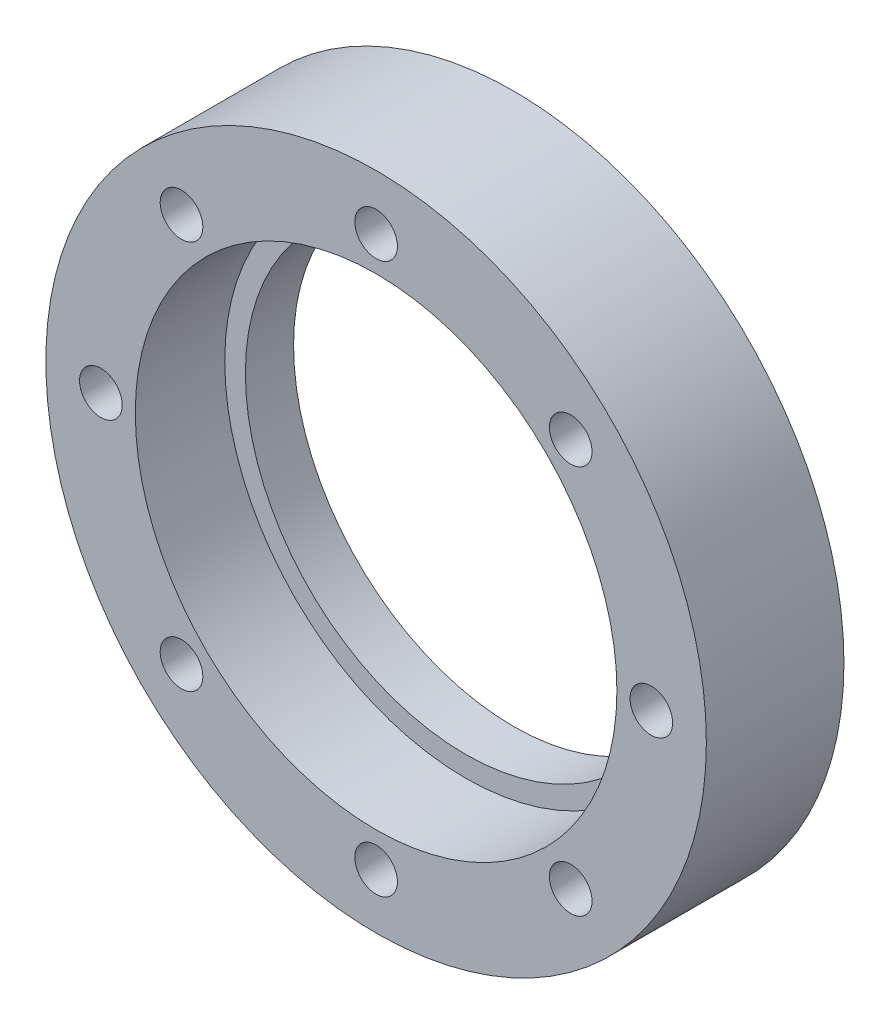
from build123d import *

# Parameters (mm, degrees)
SKETCH6_R           = 24
SKETCH6_R_2         = 1.55
SKETCH6_R_3         = 16
BOSS_EXTRUDE1_DEPTH = 10
SKETCH8_R           = 3.5
CUT_EXTRUDE6_DEPTH  = 3
SKETCH9_R           = 17.5
CUT_EXTRUDE7_DEPTH  = 6.5


with BuildPart() as part:
    # Sketch6 → Boss-Extrude1 (new body)
    with BuildSketch(Plane.XY):
        Circle(SKETCH6_R)
        with Locations((0, 20)):
            Circle(SKETCH6_R_2, mode=Mode.SUBTRACT)
        with Locations((14.142135624, 14.142135624)):
            Circle(SKETCH6_R_2, mode=Mode.SUBTRACT)
        with Locations((20, 0)):
            Circle(SKETCH6_R_2, mode=Mode.SUBTRACT)
        with Locations((14.142135624, -14.142135624)):
            Circle(SKETCH6_R_2, mode=Mode.SUBTRACT)
        with Locations((0, -20)):
            Circle(SKETCH6_R_2, mode=Mode.SUBTRACT)
        with Locations((-14.142135624, -14.142135624)):
            Circle(SKETCH6_R_2, mode=Mode.SUBTRACT)
        with Locations((-20, 0)):
            Circle(SKETCH6_R_2, mode=Mode.SUBTRACT)
        with Locations((-14.142135624, 14.142135624)):
            Circle(SKETCH6_R_2, mode=Mode.SUBTRACT)
        Circle(SKETCH6_R_3, mode=Mode.SUBTRACT)
    extrude(amount=BOSS_EXTRUDE1_DEPTH)

    # Sketch8 → Cut-Extrude6 (cut)
    with BuildSketch(Plane(origin=(0, 0, 0), x_dir=(-1, 0, 0), z_dir=(0, 0, -1))):
        with Locations((0, 20)):
            Circle(SKETCH8_R)
        with Locations((14.142135624, 14.142135624)):
            Circle(SKETCH8_R)
        with Locations((20, 0)):
            Circle(SKETCH8_R)
        with Locations((14.142135624, -14.142135624)):
            Circle(SKETCH8_R)
        with Locations((0, -20)):
            Circle(SKETCH8_R)
        with Locations((-14.142135624, -14.142135624)):
            Circle(SKETCH8_R)
        with Locations((-20, 0)):
            Circle(SKETCH8_R)
        with Locations((-14.142135624, 14.142135624)):
            Circle(SKETCH8_R)
    extrude(amount=-CUT_EXTRUDE6_DEPTH, mode=Mode.SUBTRACT)

    # Sketch9 → Cut-Extrude7 (cut)
    with BuildSketch(Plane.XY.offset(10)):
        Circle(SKETCH9_R)
    extrude(amount=-CUT_EXTRUDE7_DEPTH, mode=Mode.SUBTRACT)


solid = part.part
